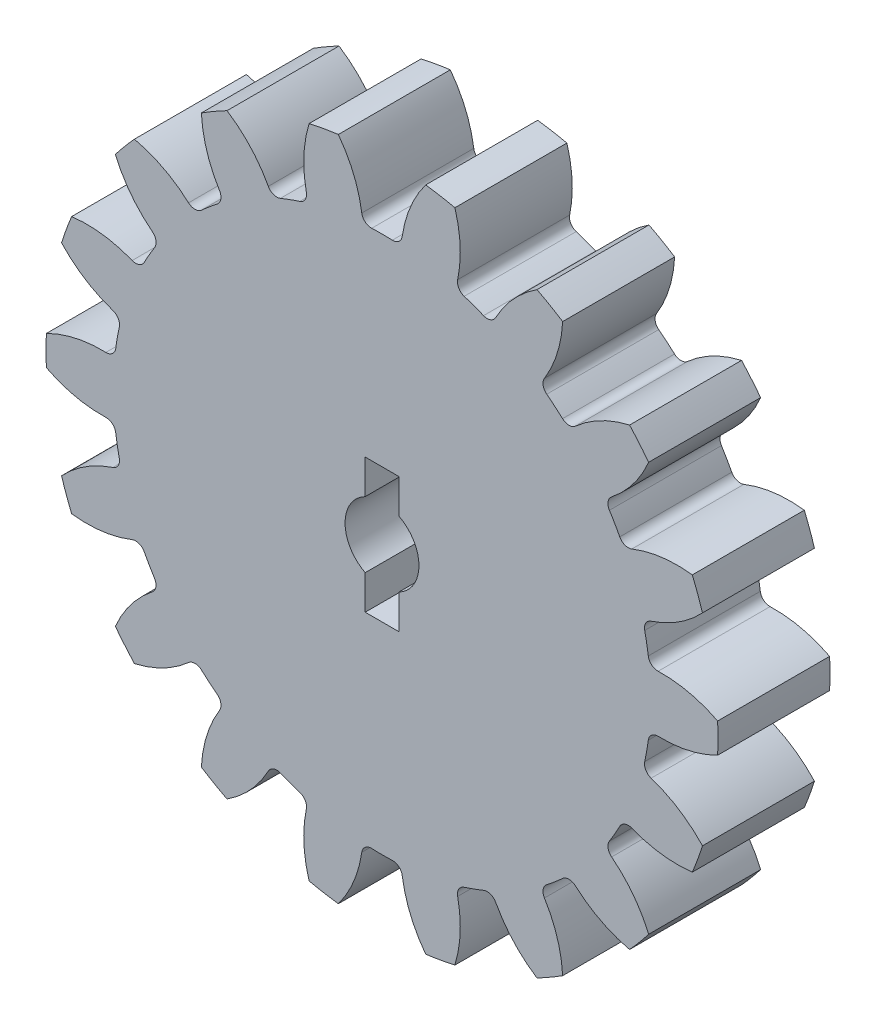
from build123d import *

# Parameters (mm, degrees)
SKETCH1_R                      = 15
BOSS_EXTRUDE1_DEPTH            = 2.5
CUT_EXTRUDE1_DEPTH             = 22.360009363
FILLET2_R                      = 0.43
CIRPATTERN1_COUNT              = 18
FILLET2_OF_CIRPATTERN1_R       = 0.43
THROUGH_CENTER_HOLE_DEPTH      = 22.27079237
THROUGH_CENTER_HOLE_DEPTH_BACK = 22.27079237


with BuildPart() as part:
    # Sketch1 → Boss-Extrude1 (new, symmetric)
    with BuildSketch(Plane.XY):
        Circle(SKETCH1_R)
    extrude(amount=BOSS_EXTRUDE1_DEPTH, both=True)

    # Sketch3 → Cut-Extrude1 (cut, symmetric)
    with BuildSketch(Plane.XY):
        with BuildLine():
            ThreePointArc((-1.950230351, 14.872679704), (-1.195470385, 13.499676366), (-0.860599488, 11.969100573))
            ThreePointArc((-0.860599488, 11.969100573), (0, 12), (0.860599488, 11.969100573))
            ThreePointArc((0.860599488, 11.969100573), (1.195470385, 13.499676366), (1.950230351, 14.872679704))
            ThreePointArc((1.950230351, 14.872679704), (0, 15), (-1.950230351, 14.872679704))
        make_face()
    cut_extrude1 = extrude(amount=CUT_EXTRUDE1_DEPTH, both=True, mode=Mode.SUBTRACT)

    # Fillet2
    fillet2_edges = [part.edges().sort_by_distance(p)[0] for p in [
        (-0.860599488, 11.969100573, 0),
        (0.860599488, 11.969100573, 0),
    ]]
    fillet(fillet2_edges, radius=FILLET2_R)

    # CirPattern1: Cut-Extrude1 ×18 about axis
    cirpattern1_axis = Axis((0, 0, 2.5), (0, 0, -1))
    for i in range(1, CIRPATTERN1_COUNT):
        add(cut_extrude1.rotate(cirpattern1_axis, i * 360 / CIRPATTERN1_COUNT), mode=Mode.SUBTRACT)

    # Fillet2 of CirPattern1
    fillet2_of_cirpattern1_edges = [part.edges().sort_by_distance(p)[0] for p in [
        (3.284974505, 11.541617846, 0),
        (4.902372482, 10.952933125, 0),
        (7.034332092, 9.722045671, 0),
        (8.352847003, 8.615680295, 0),
        (9.935245413, 6.729851305, 0),
        (10.7958449, 5.239249267, 0),
        (11.637821508, 2.925937551, 0),
        (11.936704573, 1.230887455, 0),
        (11.936704573, -1.230887455, 0),
        (11.637821508, -2.925937551, 0),
        (10.7958449, -5.239249267, 0),
        (9.935245413, -6.729851305, 0),
        (8.352847003, -8.615680295, 0),
        (7.034332092, -9.722045671, 0),
        (4.902372482, -10.952933125, 0),
        (3.284974505, -11.541617846, 0),
        (0.860599488, -11.969100573, 0),
        (-0.860599488, -11.969100573, 0),
        (-3.284974505, -11.541617846, 0),
        (-4.902372482, -10.952933125, 0),
        (-7.034332092, -9.722045671, 0),
        (-8.352847003, -8.615680295, 0),
        (-9.935245413, -6.729851305, 0),
        (-10.7958449, -5.239249267, 0),
        (-11.637821508, -2.925937551, 0),
        (-11.936704573, -1.230887455, 0),
        (-11.936704573, 1.230887455, 0),
        (-11.637821508, 2.925937551, 0),
        (-10.7958449, 5.239249267, 0),
        (-9.935245413, 6.729851305, 0),
        (-8.352847003, 8.615680295, 0),
        (-7.034332092, 9.722045671, 0),
        (-4.902372482, 10.952933125, 0),
        (-3.284974505, 11.541617846, 0),
    ]]
    fillet(fillet2_of_cirpattern1_edges, radius=FILLET2_OF_CIRPATTERN1_R)

    # Sketch4 → Through_Center_Hole (cut, two sides: drawn at the far end of the back side and taken through both)
    with BuildSketch(Plane.XY.offset(-THROUGH_CENTER_HOLE_DEPTH_BACK)):
        with BuildLine():
            Line((-0.75, 3), (0.75, 3))
            Line((0.75, 3), (0.75, 1.469693846))
            ThreePointArc((0.75, 1.469693846), (1.65, 0), (0.75, -1.469693846))
            Line((0.75, -1.469693846), (0.75, -3))
            Line((0.75, -3), (-0.75, -3))
            Line((-0.75, -3), (-0.75, -1.469693846))
            ThreePointArc((-0.75, -1.469693846), (-1.65, 0), (-0.75, 1.469693846))
            Line((-0.75, 1.469693846), (-0.75, 3))
        make_face()
    extrude(amount=THROUGH_CENTER_HOLE_DEPTH + THROUGH_CENTER_HOLE_DEPTH_BACK, mode=Mode.SUBTRACT)


solid = part.part
